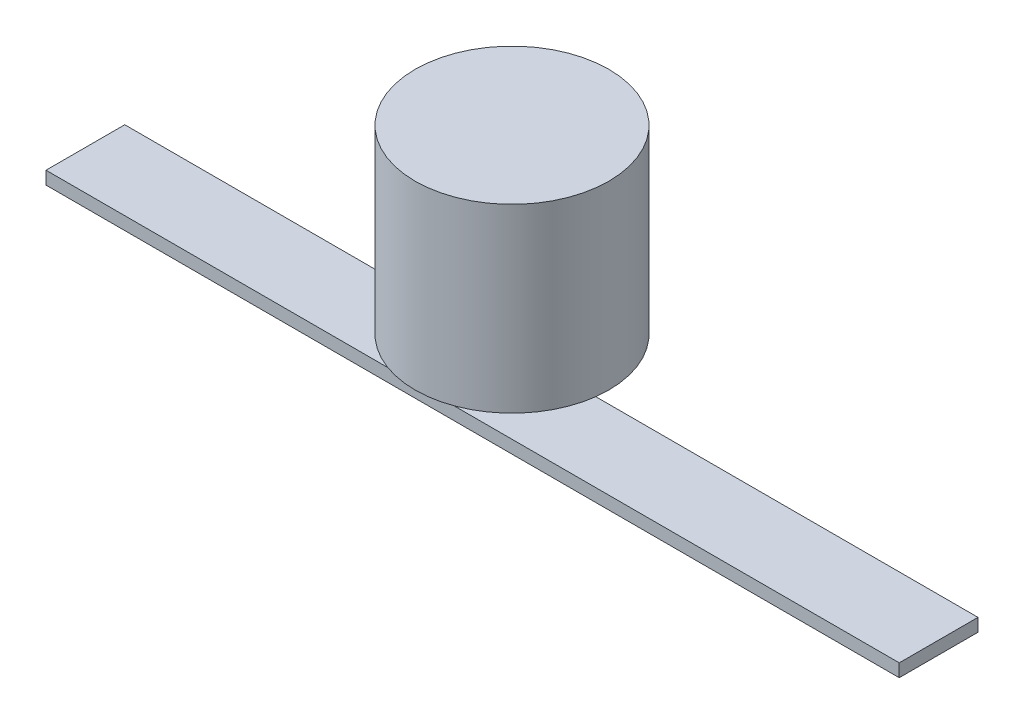
from build123d import *

# Parameters (mm, degrees)
SKETCH1_W           = 330.2
SKETCH1_H           = 30.48
BOSS_EXTRUDE1_DEPTH = 5
SKETCH2_R           = 7.5
BOSS_EXTRUDE2_DEPTH = 20
SKETCH3_R           = 37.5
BOSS_EXTRUDE3_DEPTH = 70


with BuildPart() as part:
    # Sketch1 → Boss-Extrude1 (new body)
    with BuildSketch(Plane(origin=(0, 0, 0), x_dir=(1, 0, 0), z_dir=(0, 1, 0))):
        Rectangle(SKETCH1_W, SKETCH1_H)
    extrude(amount=BOSS_EXTRUDE1_DEPTH)

    # Sketch2 → Boss-Extrude2 (add)
    with BuildSketch(Plane(origin=(0, 5, 0), x_dir=(1, 0, 0), z_dir=(0, 1, 0))):
        Circle(SKETCH2_R)
    extrude(amount=BOSS_EXTRUDE2_DEPTH)

    # Sketch3 → Boss-Extrude3 (add)
    with BuildSketch(Plane(origin=(0, 25, 0), x_dir=(1, 0, 0), z_dir=(0, 1, 0))):
        Circle(SKETCH3_R)
    extrude(amount=BOSS_EXTRUDE3_DEPTH)


solid = part.part
